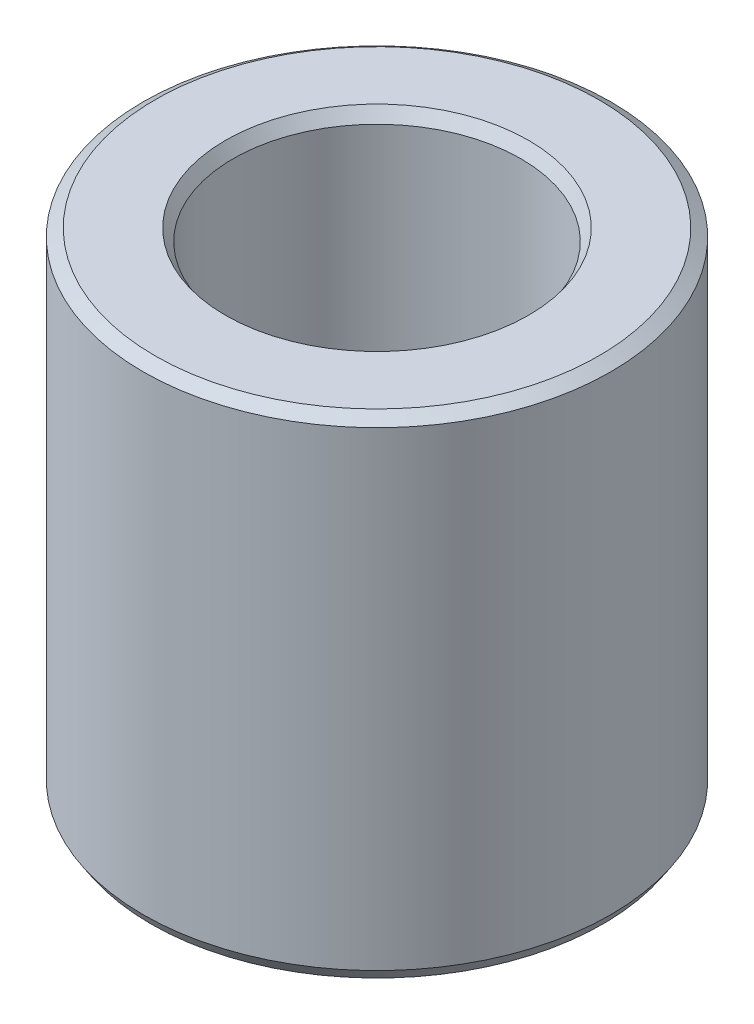
from build123d import *
from OCP.BRepFilletAPI import BRepFilletAPI_MakeChamfer

# Parameters (mm, degrees)
SKETCH1_R           = 57.5
BOSS_EXTRUDE1_DEPTH = 120.466555209
SKETCH2_R           = 35.354648894
CUT_EXTRUDE1_DEPTH  = 146.343355279
CHAMFER1_SIZE       = 1.914896633
CHAMFER1_SIZE2      = 2.942700099


with BuildPart() as part:
    # Sketch1 → Boss-Extrude1 (new body)
    with BuildSketch(Plane(origin=(0, 0, 0), x_dir=(1, 0, 0), z_dir=(0, 1, 0))):
        Circle(SKETCH1_R)
    extrude(amount=BOSS_EXTRUDE1_DEPTH)

    # Sketch2 → Cut-Extrude1 (cut, through all)
    with BuildSketch(Plane(origin=(0, 0, 0), x_dir=(1, 0, 0), z_dir=(0, 1, 0))):
        Circle(SKETCH2_R)
    extrude(amount=CUT_EXTRUDE1_DEPTH, mode=Mode.SUBTRACT)

    # Chamfer1: one chamfer whose edges measure the first distance from different faces: ONE call of the kernel's chamfer builder (chamfer() names one face for all edges)
    chamfer1_edges_1 = [part.edges().sort_by_distance(p)[0] for p in [
        (-35.354648894, 120.466555209, 0),
    ]]
    chamfer1_side_1 = [part.faces().sort_by_distance(p)[0] for p in [
        (-55.873654403, 120.466555209, 0),
    ]]
    chamfer1_edges_2 = [part.edges().sort_by_distance(p)[0] for p in [
        (-35.354648894, 0, 0),
    ]]
    chamfer1_side_2 = [part.faces().sort_by_distance(p)[0] for p in [
        (-35.354648894, 60.233277604, 0),
    ]]
    chamfer1_edges_3 = [part.edges().sort_by_distance(p)[0] for p in [
        (-57.5, 0, 0),
    ]]
    chamfer1_side_3 = [part.faces().sort_by_distance(p)[0] for p in [
        (-55.873654403, 0, 0),
    ]]
    chamfer1_edges_4 = [part.edges().sort_by_distance(p)[0] for p in [
        (-57.5, 120.466555209, 0),
    ]]
    chamfer1_side_4 = [part.faces().sort_by_distance(p)[0] for p in [
        (-57.5, 60.233277604, 0),
    ]]
    chamfer1 = BRepFilletAPI_MakeChamfer(part.part.solid().wrapped)
    for e in chamfer1_edges_1:
        chamfer1.Add(CHAMFER1_SIZE, CHAMFER1_SIZE2, e.wrapped, chamfer1_side_1[0].wrapped)  # the first distance lies on this face
    for e in chamfer1_edges_2:
        chamfer1.Add(CHAMFER1_SIZE, CHAMFER1_SIZE2, e.wrapped, chamfer1_side_2[0].wrapped)  # the first distance lies on this face
    for e in chamfer1_edges_3:
        chamfer1.Add(CHAMFER1_SIZE, CHAMFER1_SIZE2, e.wrapped, chamfer1_side_3[0].wrapped)  # the first distance lies on this face
    for e in chamfer1_edges_4:
        chamfer1.Add(CHAMFER1_SIZE, CHAMFER1_SIZE2, e.wrapped, chamfer1_side_4[0].wrapped)  # the first distance lies on this face
    add(Compound.cast(chamfer1.Shape()), mode=Mode.REPLACE)


solid = part.part
